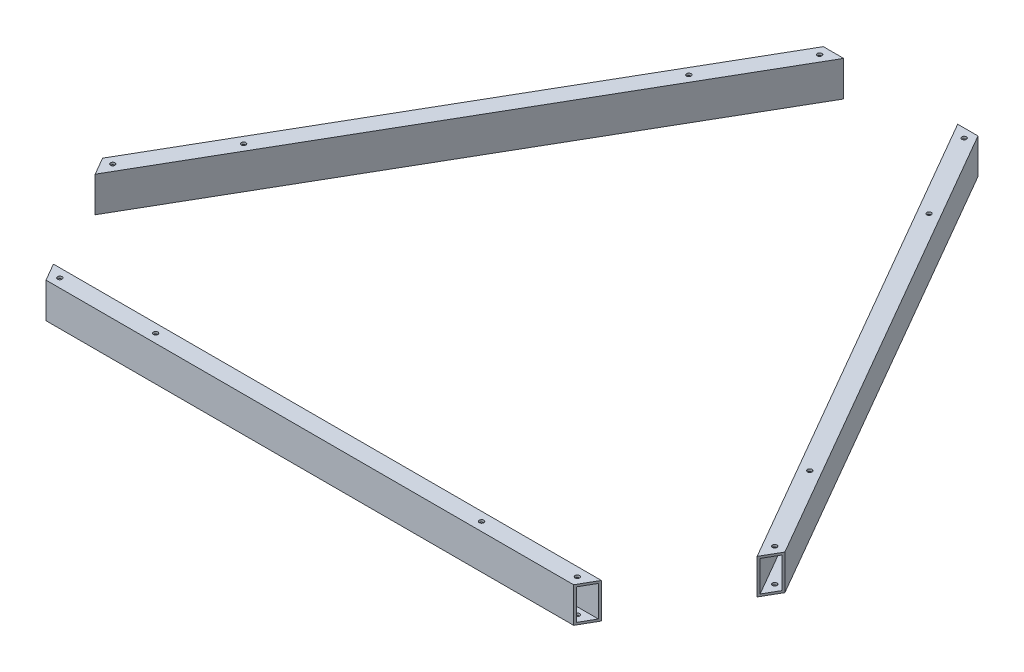
from build123d import *

# Parameters (mm, degrees)
SKETCH1_R             = 3.2512
BOSS_EXTRUDE1_DEPTH   = 50.8
BOSS_EXTRUDE1_2_DEPTH = 50.8
BOSS_EXTRUDE1_3_DEPTH = 50.8
SKETCH2_W             = 22.979393675
SKETCH2_H             = 44.45
CUT_EXTRUDE1_DEPTH    = 1368.894246246
SKETCH3_W             = 22.979393675
SKETCH3_H             = 44.45
CUT_EXTRUDE2_DEPTH    = 1369.10617446
SKETCH4_W             = 22.979393675
SKETCH4_H             = 44.45
CUT_EXTRUDE3_DEPTH    = 1368.894246246


with BuildPart() as part:
    # Sketch1 → Boss-Extrude1 (new body)
    with BuildSketch(Plane(origin=(0, 0, 0), x_dir=(1, 0, 0), z_dir=(0, 1, 0))):
        Polygon((-91.622561683, 311.43741361), (-120.951955358, 311.43741361), (-501.951955358, -348.473944074), (-487.28725852, -373.873944074), align=None)
        with Locations((-182.775733158, 178.955489344)):
            Circle(SKETCH1_R, mode=Mode.SUBTRACT)
        with Locations((-113.619606939, 298.73741361)):
            Circle(SKETCH1_R, mode=Mode.SUBTRACT)
        with Locations((-418.131132301, -228.692019808)):
            Circle(SKETCH1_R, mode=Mode.SUBTRACT)
        with Locations((-487.28725852, -348.473944074)):
            Circle(SKETCH1_R, mode=Mode.SUBTRACT)
    extrude(amount=BOSS_EXTRUDE1_DEPTH)

    # Sketch3 → Cut-Extrude2 (cut, through all, along a direction that is not the sketch's normal)
    with BuildSketch(Plane(origin=(-527.357610581, 0, 304.470058428), x_dir=(0.5000000000000041, 0, 0.8660254037844364), z_dir=(-0.8660254037844363, 0, 0.500000000000004))):
        with Locations((65.476007283, 25.4)):
            Rectangle(SKETCH3_W, SKETCH3_H)
    extrude(amount=-CUT_EXTRUDE2_DEPTH, dir=(-0.4999999999999999, 0, 0.8660254037844386), mode=Mode.SUBTRACT)


with BuildPart() as body_2:
    # Sketch1 → Boss-Extrude1 2 (new body)
    with BuildSketch(Plane(origin=(0, 0, 0), x_dir=(1, 0, 0), z_dir=(0, 1, 0))):
        Polygon((102.357864784, 311.43741361), (73.028471109, 311.43741361), (468.693167946, -373.873944074), (483.357864784, -348.473944074), align=None)
        with Locations((164.181642584, 178.955489344)):
            Circle(SKETCH1_R, mode=Mode.SUBTRACT)
        with Locations((95.025516365, 298.73741361)):
            Circle(SKETCH1_R, mode=Mode.SUBTRACT)
        with Locations((399.537041727, -228.692019808)):
            Circle(SKETCH1_R, mode=Mode.SUBTRACT)
        with Locations((468.693167946, -348.473944074)):
            Circle(SKETCH1_R, mode=Mode.SUBTRACT)
    extrude(amount=BOSS_EXTRUDE1_2_DEPTH)

    # Sketch4 → Cut-Extrude3 (cut, through all, along a direction that is not the sketch's normal)
    with BuildSketch(Plane(origin=(513.41204265, 0, 296.418581029), x_dir=(0.499999999999998, 0, -0.8660254037844398), z_dir=(0.8660254037844399, 0, 0.49999999999999806))):
        with Locations((-74.77305257, 25.4)):
            Rectangle(SKETCH4_W, SKETCH4_H)
    extrude(amount=-CUT_EXTRUDE3_DEPTH, dir=(0.4999999999999999, 0, 0.8660254037844386), mode=Mode.SUBTRACT)


with BuildPart() as body_3:
    # Sketch1 → Boss-Extrude1 3 (new body)
    with BuildSketch(Plane(origin=(0, 0, 0), x_dir=(1, 0, 0), z_dir=(0, 1, 0))):
        Polygon((-390.297045287, -541.865921231), (371.702954713, -541.865921231), (386.36765155, -516.465921231), (-404.961742124, -516.465921231), align=None)
        with Locations((-382.964696868, -529.165921231)):
            Circle(SKETCH1_R, mode=Mode.SUBTRACT)
        with Locations((-244.65244443, -529.165921231)):
            Circle(SKETCH1_R, mode=Mode.SUBTRACT)
        with Locations((364.370606294, -529.165921231)):
            Circle(SKETCH1_R, mode=Mode.SUBTRACT)
        with Locations((226.058353856, -529.165921231)):
            Circle(SKETCH1_R, mode=Mode.SUBTRACT)
    extrude(amount=BOSS_EXTRUDE1_3_DEPTH)

    # Sketch2 → Cut-Extrude1 (cut, through all, along a direction that is not the sketch's normal)
    with BuildSketch(Plane(origin=(513.41204265, 0, 296.418581029), x_dir=(0.499999999999998, 0, -0.8660254037844398), z_dir=(0.8660254037844399, 0, 0.49999999999999806))):
        with Locations((-268.753479037, 25.4)):
            Rectangle(SKETCH2_W, SKETCH2_H)
    extrude(amount=-CUT_EXTRUDE1_DEPTH, dir=(1, 0, 0), mode=Mode.SUBTRACT)


solid = Compound([part.part, body_2.part, body_3.part])
